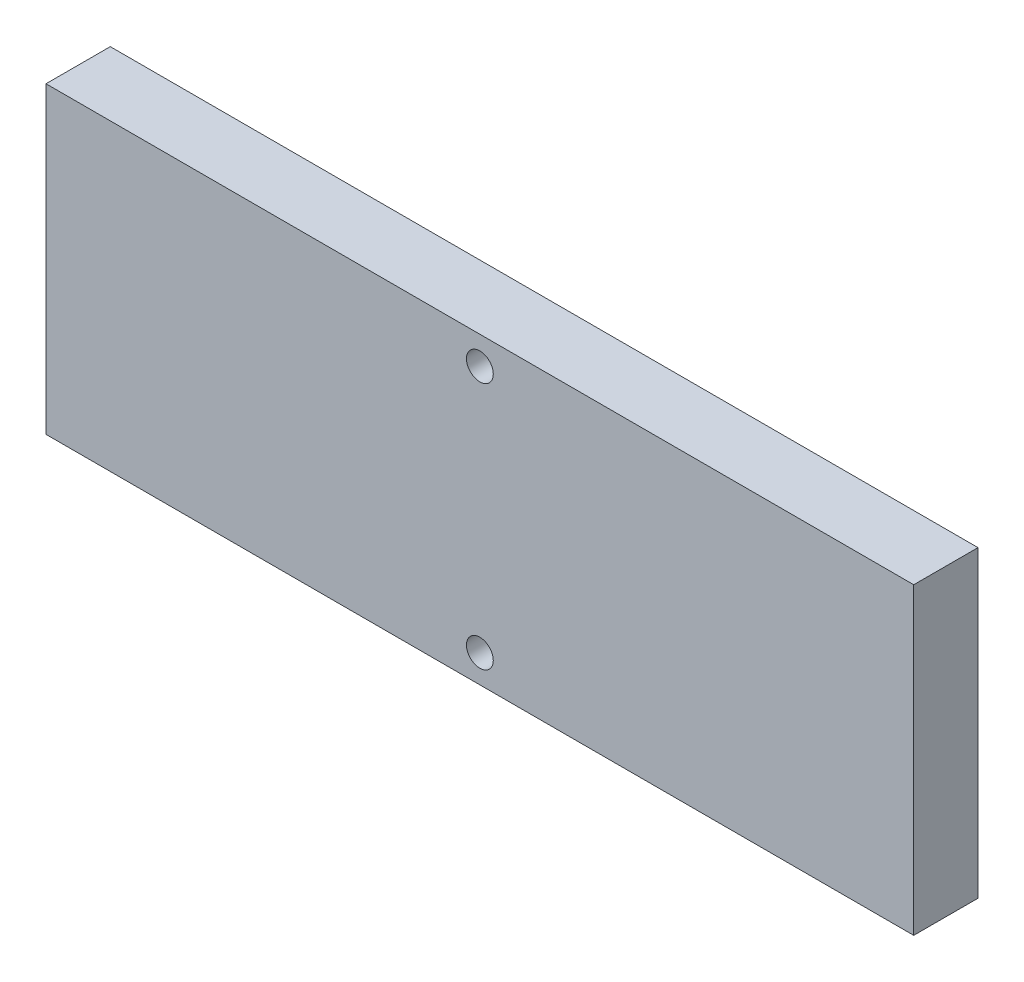
from build123d import *

# Parameters (mm, degrees)
SKETCH1_W            = 171.45
SKETCH1_H            = 60
BOSS_EXTRUDE1_DEPTH  = 6.35
M5_CLEARANCE_HOLE1_D = 5.3


with BuildPart() as part:
    # Sketch1 → Boss-Extrude1 (new, symmetric)
    with BuildSketch(Plane.XY):
        Rectangle(SKETCH1_W, SKETCH1_H)
    extrude(amount=BOSS_EXTRUDE1_DEPTH, both=True)

    # M5 Clearance Hole1 (through all)
    with Locations(Plane.XY.offset(6.35)):
        with Locations((0, 24.5), (0, -24.5)):
            Hole(M5_CLEARANCE_HOLE1_D / 2)


solid = part.part
